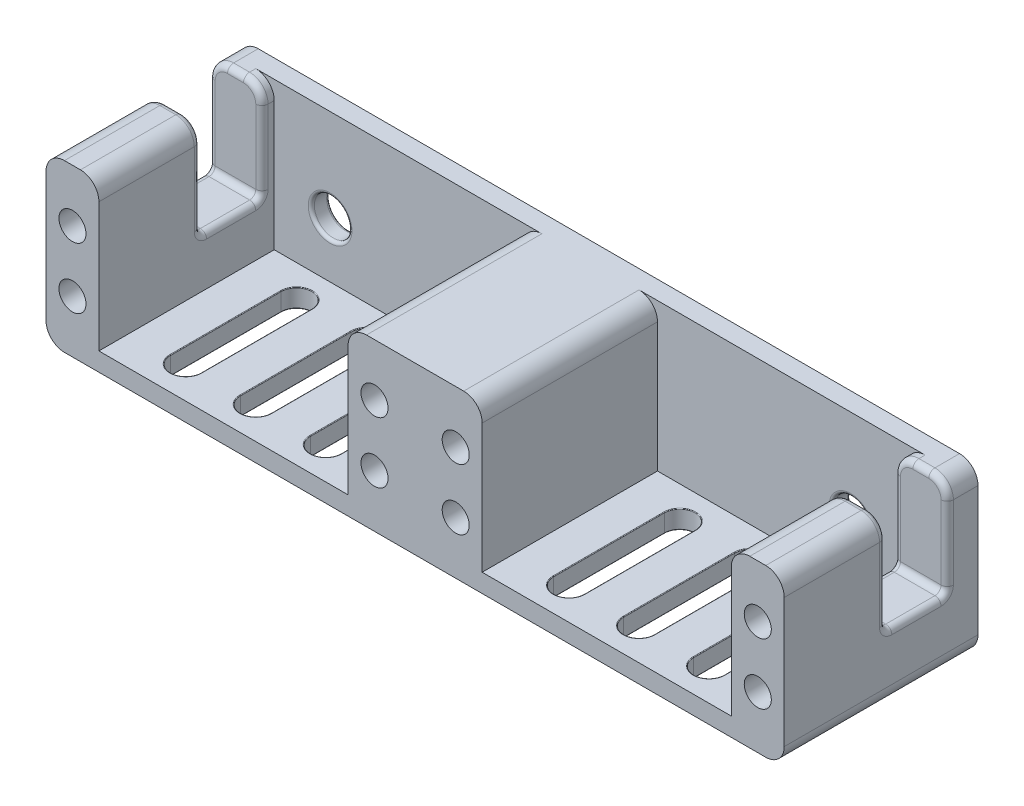
from build123d import *

# Parameters (mm, degrees)
BOSS_EXTRUDE1_DEPTH = 27
SKETCH2_R           = 2.2
CUT_EXTRUDE1_DEPTH  = 5
SKETCH4_W           = 40.5
SKETCH4_H           = 21
CUT_EXTRUDE2_DEPTH  = 28.5
SKETCH5_W           = 40.5
SKETCH5_H           = 3
CUT_EXTRUDE4_DEPTH  = 28.5
CUT_EXTRUDE7_DEPTH  = 3
SKETCH6_W           = 10
SKETCH6_H           = 16
CUT_EXTRUDE5_DEPTH  = 28.5
FILLET1_R           = 3
FILLET2_R           = 1
SKETCH9_R           = 3.05
CUT_EXTRUDE6_DEPTH  = 10
FILLET3_R           = 0.5
CUT_EXTRUDE8_DEPTH  = 0.1
FILLET4_R           = 0.1


with BuildPart() as part:
    # Sketch1 → Boss-Extrude1 (new body)
    with BuildSketch(Plane(origin=(0, 0, 0), x_dir=(1, 0, 0), z_dir=(0, 1, 0))):
        Polygon((0, 0), (60, 0), (60, -31.5), (0, -31.5), (0, -26.5), (0, -3), align=None)
    extrude(amount=BOSS_EXTRUDE1_DEPTH)

    # Sketch2 → Cut-Extrude1 (cut)
    with BuildSketch(Plane.XY.offset(31.5)):
        with Locations((4.3, 18.45)):
            Circle(SKETCH2_R)
        with Locations((4.3, 8.55)):
            Circle(SKETCH2_R)
        with Locations((53.4, 18.45)):
            Circle(SKETCH2_R)
        with Locations((53.4, 8.55)):
            Circle(SKETCH2_R)
    extrude(amount=-CUT_EXTRUDE1_DEPTH, mode=Mode.SUBTRACT)

    # Sketch4 → Cut-Extrude2 (cut)
    with BuildSketch(Plane.XY.offset(31.5)):
        with Locations((28.85, 13.5)):
            Rectangle(SKETCH4_W, SKETCH4_H)
    extrude(amount=-CUT_EXTRUDE2_DEPTH, mode=Mode.SUBTRACT)

    # Sketch5 → Cut-Extrude4 (cut)
    with BuildSketch(Plane.XY.offset(31.5)):
        with Locations((28.85, 25.5)):
            Rectangle(SKETCH5_W, SKETCH5_H)
    extrude(amount=-CUT_EXTRUDE4_DEPTH, mode=Mode.SUBTRACT)

    # Sketch10 → Cut-Extrude7 (cut)
    with BuildSketch(Plane(origin=(0, 3, 0), x_dir=(1, 0, 0), z_dir=(0, 1, 0))):
        with BuildLine():
            Line((31.35, -26.25), (31.35, -8.25))
            ThreePointArc((31.35, -8.25), (28.85, -5.75), (26.35, -8.25))
            Line((26.35, -8.25), (26.35, -26.25))
            ThreePointArc((26.35, -26.25), (28.85, -28.75), (31.35, -26.25))
        make_face()
        with BuildLine():
            Line((42.73, -26.25), (42.73, -8.25))
            ThreePointArc((42.73, -8.25), (40.23, -5.75), (37.73, -8.25))
            Line((37.73, -8.25), (37.73, -26.25))
            ThreePointArc((37.73, -26.25), (40.23, -28.75), (42.73, -26.25))
        make_face()
        with BuildLine():
            Line((19.97, -26.25), (19.97, -8.25))
            ThreePointArc((19.97, -8.25), (17.47, -5.75), (14.97, -8.25))
            Line((14.97, -8.25), (14.97, -26.25))
            ThreePointArc((14.97, -26.25), (17.47, -28.75), (19.97, -26.25))
        make_face()
    extrude(amount=-CUT_EXTRUDE7_DEPTH, mode=Mode.SUBTRACT)

    # Sketch6 → Cut-Extrude5 (cut)
    with BuildSketch(Plane(origin=(8.6, 0, 0), x_dir=(0, 0, -1), z_dir=(1, 0, 0))):
        with Locations((-10, 19)):
            Rectangle(SKETCH6_W, SKETCH6_H)
    extrude(amount=-CUT_EXTRUDE5_DEPTH, mode=Mode.SUBTRACT)

    # Fillet1
    fillet1_edges = [part.edges().sort_by_distance(p)[0] for p in [
        (8.6, 27, 23.25),
        (0, 27, 23.25),
        (0, 27, 2.5),
        (8.6, 27, 4),
        (49.1, 27, 17.25),
        (0, 0, 15.75),
    ]]
    fillet(fillet1_edges, radius=FILLET1_R)

    # Fillet2
    fillet2_edges = [part.edges().sort_by_distance(p)[0] for p in [
        (4.3, 11, 15),
        (0, 17.5, 5),
        (0, 11, 10),
        (4.3, 11, 5),
        (8.6, 11, 10),
        (8.6, 17.5, 5),
        (0, 17.5, 15),
        (4.3, 27, 5),
        (7.721320344, 26.121320344, 5),
        (0.878679656, 26.121320344, 5),
        (8.6, 17.5, 15),
        (4.3, 27, 15),
        (7.721320344, 26.121320344, 15),
        (0.878679656, 26.121320344, 15),
    ]]
    fillet(fillet2_edges, radius=FILLET2_R)

    # Sketch9 → Cut-Extrude6 (cut)
    with BuildSketch(Plane(origin=(0, 0, 0), x_dir=(-1, 0, 0), z_dir=(0, 0, -1))):
        with Locations((-17.68, 12)):
            Circle(SKETCH9_R)
    extrude(amount=-CUT_EXTRUDE6_DEPTH, mode=Mode.SUBTRACT)

    # Fillet3
    fillet3_edges = [part.edges().sort_by_distance(p)[0] for p in [
        (20.73, 12, 3),
        (20.73, 12, 0),
    ]]
    fillet(fillet3_edges, radius=FILLET3_R)

    # Sketch12 → Cut-Extrude8 (cut)
    with BuildSketch(Plane(origin=(0, 0, 0), x_dir=(-1, 0, 0), z_dir=(0, 0, -1))):
        with BuildLine():
            Line((-60, 15), (-35, 15))
            ThreePointArc((-35, 15), (-33.5, 13.5), (-35, 12))
            Line((-35, 12), (-60, 12))
            Line((-60, 12), (-60, 15))
        make_face()
        with BuildLine():
            Line((-60, 7.5), (-35, 7.5))
            ThreePointArc((-35, 7.5), (-33.5, 6), (-35, 4.5))
            Line((-35, 4.5), (-60, 4.5))
            Line((-60, 4.5), (-60, 7.5))
        make_face()
        with BuildLine():
            Line((-60, 22.5), (-60, 19.5))
            Line((-60, 19.5), (-35, 19.5))
            ThreePointArc((-35, 19.5), (-33.5, 21), (-35, 22.5))
            Line((-35, 22.5), (-60, 22.5))
        make_face()
    extrude(amount=-CUT_EXTRUDE8_DEPTH, mode=Mode.SUBTRACT)

    # Fillet4
    fillet4_edges = [part.edges().sort_by_distance(p)[0] for p in [
        (47.5, 4.5, 0),
        (33.5, 6, 0),
        (47.5, 12, 0),
        (33.5, 13.5, 0),
        (47.5, 19.5, 0),
        (33.5, 21, 0),
        (47.5, 7.5, 0),
        (47.5, 15, 0),
        (47.5, 22.5, 0),
        (14.97, 3, 17.25),
        (17.47, 3, 5.75),
        (19.97, 3, 17.25),
        (26.35, 3, 17.25),
        (28.85, 3, 5.75),
        (31.35, 3, 17.25),
        (37.73, 3, 17.25),
        (40.23, 3, 5.75),
        (42.73, 3, 17.25),
        (40.23, 0, 5.75),
        (42.73, 0, 17.25),
        (40.23, 0, 28.75),
        (26.35, 0, 17.25),
        (28.85, 0, 5.75),
        (31.35, 0, 17.25),
        (17.47, 0, 28.75),
        (14.97, 0, 17.25),
        (17.47, 0, 5.75),
        (17.47, 3, 28.75),
        (28.85, 3, 28.75),
        (40.23, 3, 28.75),
        (37.73, 0, 17.25),
        (28.85, 0, 28.75),
        (19.97, 0, 17.25),
    ]]
    fillet(fillet4_edges, radius=FILLET4_R - 0.0001)  # a hair under: the kernel refuses the full size

    # Mirror1: part across plane


with BuildPart() as part_1:
    add(part.part)
    add(part.part.mirror(Plane(origin=(60, 27, 0), x_dir=(0, 0, 1), z_dir=(-1, 0, 0))))


solid = part_1.part
